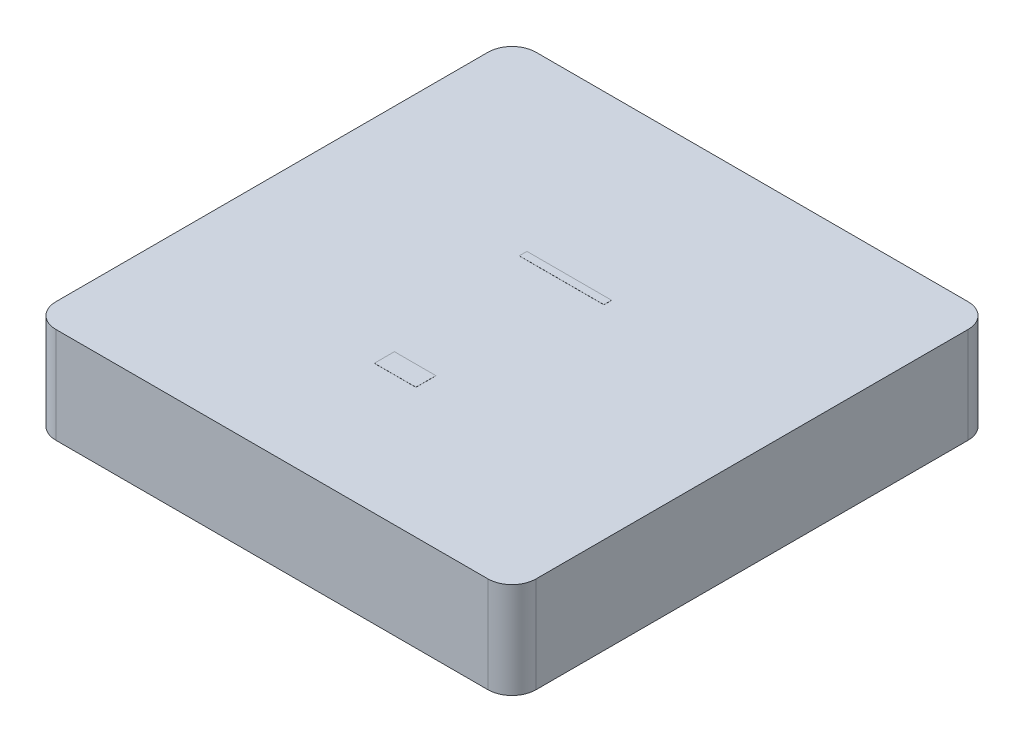
from build123d import *

# Parameters (mm, degrees)
SKETCH1_W           = 12.7
SKETCH1_H           = 12.7
BOSS_EXTRUDE1_DEPTH = 2.54
FILLET1_R           = 0.635
SHELL1_START        = 0.635
SHELL1_OUTLINE_W    = 1.905
SHELL1_OUTLINE_H    = 11.43
SHELL1_DEPTH        = 11.43
SKETCH2_R           = 2.54
BOSS_EXTRUDE2_DEPTH = 1.905
SKETCH4_W           = 1.099038461
SKETCH4_H           = 0.529166666
SKETCH4_W_2         = 2.238782051
SKETCH4_H_2         = 0.203525641
BOSS_EXTRUDE4_DEPTH = 0.00254


# Read off the part's stored shape, not the designer's step: Shell1
with BuildPart() as part:
    # Sketch1 → Boss-Extrude1 (new body)
    with BuildSketch(Plane(origin=(0, 0, 0), x_dir=(1, 0, 0), z_dir=(0, 1, 0))):
        with Locations((6.35, 6.35)):
            Rectangle(SKETCH1_W, SKETCH1_H)
    extrude(amount=BOSS_EXTRUDE1_DEPTH)

    # Fillet1
    fillet1_edges = [part.edges().sort_by_distance(p)[0] for p in [
        (0, 1.27, -12.7),
        (12.7, 1.27, -12.7),
        (12.7, 1.27, 0),
        (0, 1.27, 0),
    ]]
    fillet(fillet1_edges, radius=FILLET1_R)

    # Shell1 outline → Shell1 (cut)
    with BuildSketch(Plane.YZ.offset(SHELL1_START)):
        with Locations((0.9525, -6.35)):
            Rectangle(SHELL1_OUTLINE_W, SHELL1_OUTLINE_H)
    extrude(amount=SHELL1_DEPTH, mode=Mode.SUBTRACT)

    # Sketch2 → Boss-Extrude2 (add)
    with BuildSketch(Plane(origin=(0, 1.905, 0), x_dir=(-1, 0, 0), z_dir=(0, -1, 0))):
        with Locations(Location((-6.35, 6.35, 0), (0, 0, 270))):
            Circle(SKETCH2_R)
    extrude(amount=BOSS_EXTRUDE2_DEPTH)

    # Sketch4 → Boss-Extrude4 (add)
    with BuildSketch(Plane(origin=(0, 2.54, 0), x_dir=(1, 0, 0), z_dir=(0, 1, 0))):
        with Locations((6.173665384, 3.700096154)):
            Rectangle(SKETCH4_W, SKETCH4_H)
        with Locations((6.199391026, 7.913891026)):
            Rectangle(SKETCH4_W_2, SKETCH4_H_2)
    extrude(amount=BOSS_EXTRUDE4_DEPTH)


solid = part.part
